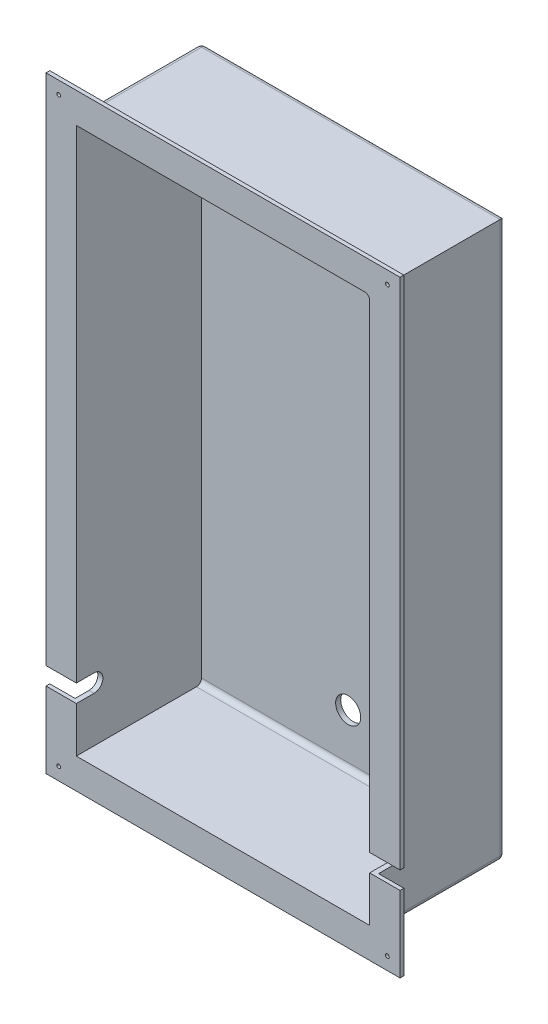
from build123d import *

# Parameters (mm, degrees)
SKETCH1_W               = 120
SKETCH1_H               = 220
BOSS_EXTRUDE1_DEPTH     = 50
SKETCH2_W               = 140
SKETCH2_H               = 240
BOSS_EXTRUDE2_DEPTH     = 1.5
SHELL1_T                = 2
CUT_EXTRUDE1_DEPTH      = 183.855817518
CUT_EXTRUDE1_DEPTH_BACK = 183.855817518
FILLET1_R               = 2
FILLET2_R               = 2
SKETCH9_R               = 4.951117386
CUT_EXTRUDE2_DEPTH      = 149.162917088
F_1_5MM_DOWEL_HOLE1_D   = 1.5


with BuildPart() as part:
    # Sketch1 → Boss-Extrude1 (new body)
    with BuildSketch(Plane.XY):
        Rectangle(SKETCH1_W, SKETCH1_H)
    extrude(amount=BOSS_EXTRUDE1_DEPTH)

    # Sketch2 → Boss-Extrude2 (add)
    with BuildSketch(Plane.XY.offset(50)):
        Rectangle(SKETCH2_W, SKETCH2_H)
    extrude(amount=BOSS_EXTRUDE2_DEPTH)

    # Shell1
    # the kernel refuses this shell: the inside is offset whole and opened at the faces by hand
    shell1_offset = offset(amount=-SHELL1_T, mode=Mode.PRIVATE)
    shell1_offset = shell1_offset + extrude(shell1_offset.faces().sort_by_distance((0, 0, 49.5))[0], amount=SHELL1_T, mode=Mode.PRIVATE)
    add(shell1_offset, mode=Mode.SUBTRACT)

    # Sketch8 → Cut-Extrude1 (cut, two sides: drawn at the far end of the back side and taken through both)
    with BuildSketch(Plane.ZY.offset(-58).offset(-CUT_EXTRUDE1_DEPTH_BACK)):
        with BuildLine():
            Line((51.5, -83), (44.5, -83))
            ThreePointArc((44.5, -83), (41, -86.5), (44.5, -90))
            Line((44.5, -90), (51.5, -90))
            Line((51.5, -90), (51.5, -83))
        make_face()
    extrude(amount=CUT_EXTRUDE1_DEPTH + CUT_EXTRUDE1_DEPTH_BACK, mode=Mode.SUBTRACT)

    # Fillet1
    fillet1_edges = [part.edges().sort_by_distance(p)[0] for p in [
        (0, -108, 2),
        (-60, 0, 0),
        (0, 110, 0),
        (60, 0, 0),
    ]]
    fillet(fillet1_edges, radius=FILLET1_R)

    # Fillet2
    # the kernel refuses this fillet: 2 mm, written as the material it adds along each edge
    with BuildSketch(Plane(origin=(58, 108, 51.5), x_dir=(0, -1, 0), z_dir=(0, 0, -1))) as fillet2_piece_1:
        with BuildLine():
            CenterArc((FILLET2_R, FILLET2_R), FILLET2_R, 180, 90)
            Line((0, FILLET2_R), (0, 0))
            Line((0, 0), (FILLET2_R, 0))
        make_face()
    extrude(amount=49.5)
    # the kernel refuses this fillet: 2 mm, written as the material it takes off along each edge
    with BuildSketch(Plane(origin=(-58, 108, 2), x_dir=(0, 1, 0), z_dir=(-1, 0, 0))) as fillet2_2_piece_1_section:
        Polygon((0, 0), (FILLET2_R * 1.02, 0), (FILLET2_R * 1.02, FILLET2_R * 1.02), (0, FILLET2_R * 1.02), align=None)
    fillet2_2_piece_1 = extrude(amount=FILLET2_R * 1.02, mode=Mode.PRIVATE)
    fillet2_2_piece_1 = fillet2_2_piece_1 - Plane(origin=(-58, 108, 2), x_dir=(0, -0.7071067811865475, 0.7071067811865475), z_dir=(-1, 0, 0)) * Sphere(FILLET2_R, mode=Mode.PRIVATE)
    add(fillet2_2_piece_1, mode=Mode.SUBTRACT)
    with BuildSketch(Plane(origin=(60, -110, 2), x_dir=(-1, 0, 0), z_dir=(0, 0, 1)), Plane(origin=(-60, -110, 2), x_dir=(0, 1, 0), z_dir=(0, 0, 1))) as fillet2_2_piece_2:
        with BuildLine():
            CenterArc((FILLET2_R, -FILLET2_R), FILLET2_R, 90, 90)
            Line((0, -FILLET2_R), (0, 0))
            Line((0, 0), (FILLET2_R, 0))
        make_face()
    extrude(amount=48, mode=Mode.SUBTRACT)
    with BuildSketch(Plane(origin=(-60, 110, 2), x_dir=(0, -1, 0), z_dir=(0, 0, 1))) as fillet2_2_piece_3:
        with BuildLine():
            CenterArc((FILLET2_R, FILLET2_R), FILLET2_R, 180, 90)
            Line((0, FILLET2_R), (0, 0))
            Line((0, 0), (FILLET2_R, 0))
        make_face()
    extrude(amount=48, mode=Mode.SUBTRACT)
    with BuildSketch(Plane(origin=(58, -110, 0), x_dir=(0, 0, 1), z_dir=(-1, 0, 0))) as fillet2_2_piece_4:
        with BuildLine():
            CenterArc((FILLET2_R, FILLET2_R), FILLET2_R, 180, 90)
            Line((0, FILLET2_R), (0, 0))
            Line((0, 0), (FILLET2_R, 0))
        make_face()
    extrude(amount=116, mode=Mode.SUBTRACT)
    with BuildSketch(Plane(origin=(58, -110, 2), x_dir=(1, 0, 0), z_dir=(0, 0, 1))) as fillet2_2_piece_5:
        with BuildLine():
            CenterArc((2 - FILLET2_R, FILLET2_R), FILLET2_R, 270, 90)
            Line((2, FILLET2_R), (2, 0))
            Line((2, 0), (2 - FILLET2_R, 0))
        make_face()
    revolve(axis=Axis((58, -110, 2), (0, 1, 0)), revolution_arc=90, mode=Mode.SUBTRACT)
    with BuildSketch(Plane(origin=(-58, -110, 2), x_dir=(-1, 0, 0), z_dir=(0, 0, 1))) as fillet2_2_piece_6:
        with BuildLine():
            CenterArc((2 - FILLET2_R, -FILLET2_R), FILLET2_R, 0, 90)
            Line((2 - FILLET2_R, 0), (2, 0))
            Line((2, 0), (2, -FILLET2_R))
        make_face()
    revolve(axis=Axis((-58, -110, 2), (0, -1, 0)), revolution_arc=90, mode=Mode.SUBTRACT)

    # Sketch9 → Cut-Extrude2 (cut, through all)
    with BuildSketch(Plane(origin=(0, 0, 0), x_dir=(-1, 0, 0), z_dir=(0, 0, -1))):
        with Locations((0, -88)):
            Circle(SKETCH9_R)
    extrude(amount=-CUT_EXTRUDE2_DEPTH, mode=Mode.SUBTRACT)

    # Ø1.5mm Dowel Hole1 (through all)
    with Locations(Plane(origin=(-164.627139737, -264.125226739, 50), x_dir=(-1, 0, 0), z_dir=(0, 0, -1))):
        with Locations((-229.627139737, 379.125226739), (-99.627139737, 379.125226739), (-229.627139737, 149.125226739), (-99.627139737, 149.125226739)):
            Hole(F_1_5MM_DOWEL_HOLE1_D / 2)


solid = part.part
